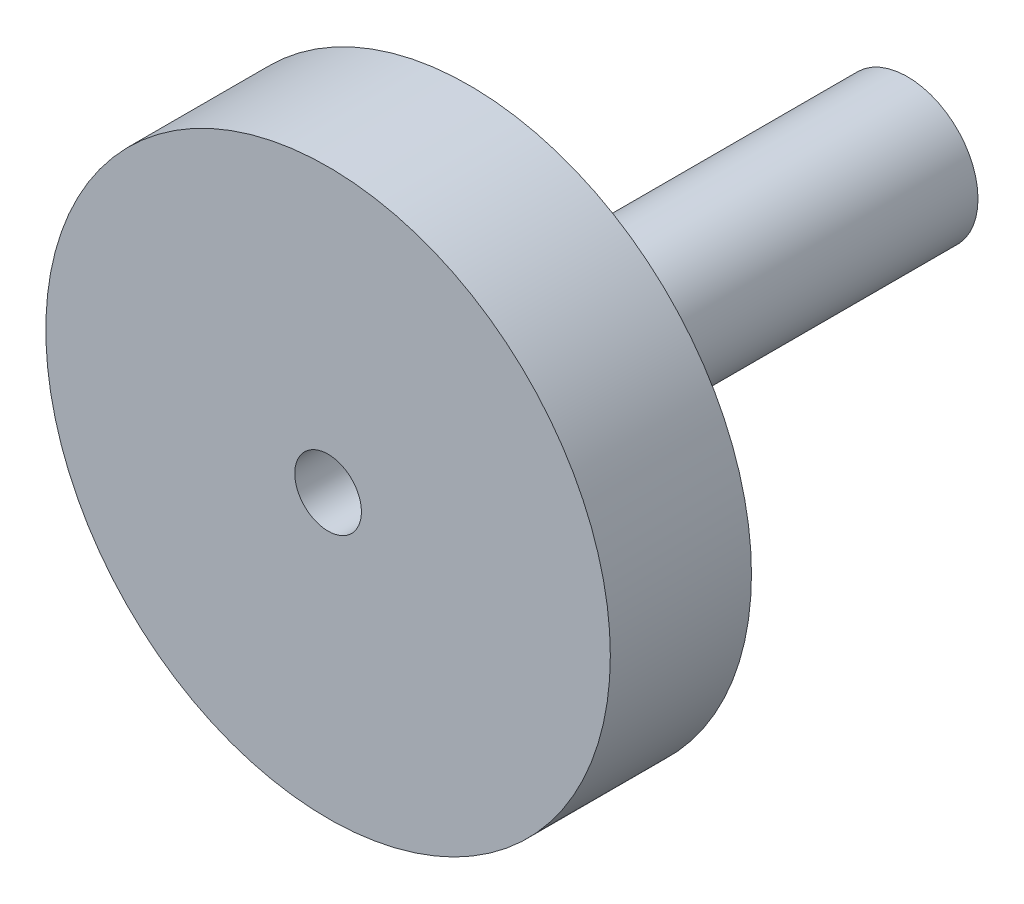
from build123d import *

# Parameters (mm, degrees)
SKETCH2_R          = 1.5
CUT_EXTRUDE1_DEPTH = 9.525


with BuildPart() as part:
    # Sketch1 → Revolve1 (revolve)
    with BuildSketch(Plane(origin=(0, 0, 0), x_dir=(0, 0, -1), z_dir=(1, 0, 0))):
        Polygon((0, 0), (-3.175, 0), (-3.175, 12.7), (3.175, 12.7), (3.175, 3.175), (22.89175, 3.175), (22.89175, 0), align=None)
    revolve(axis=Axis((0, 0, 0), (0, 0, -1)))

    # Sketch2 → Cut-Extrude1 (cut)
    with BuildSketch(Plane.XY.offset(3.175)):
        Circle(SKETCH2_R)
    extrude(amount=-CUT_EXTRUDE1_DEPTH, mode=Mode.SUBTRACT)


solid = part.part
